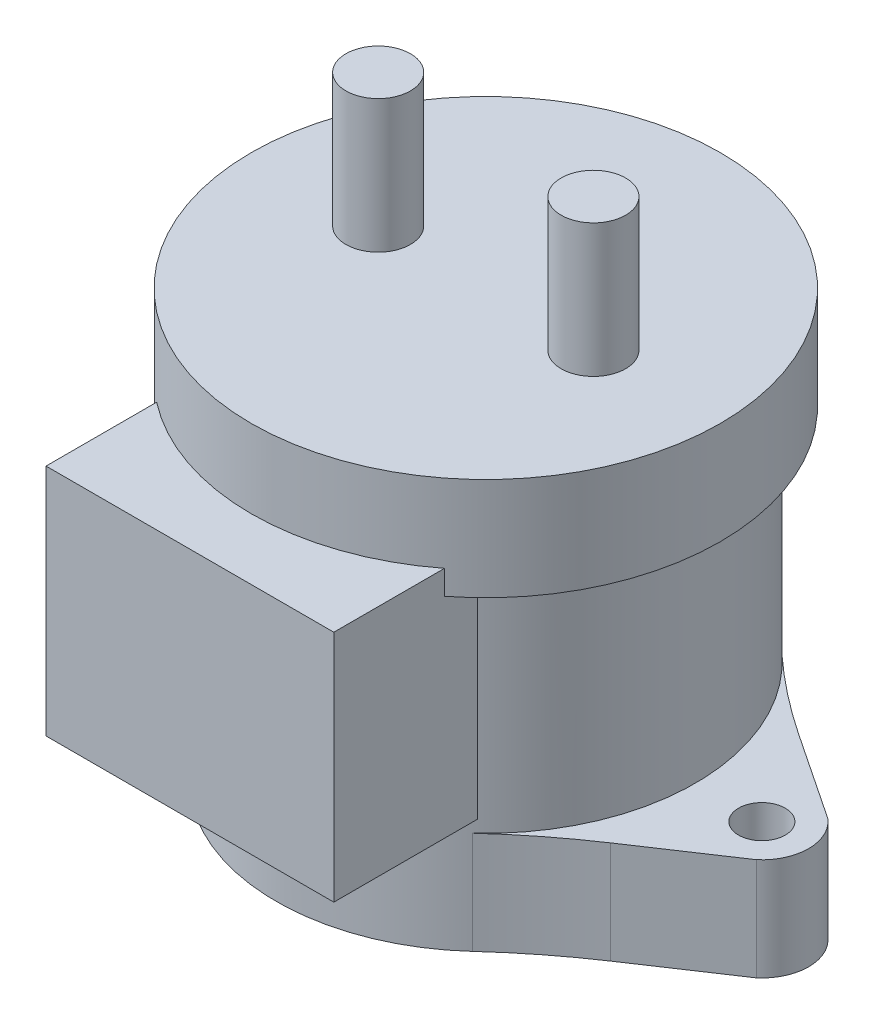
from build123d import *

# Parameters (mm, degrees)
SKETCH1_R           = 26
BOSS_EXTRUDE1_DEPTH = 14.2
SKETCH4_R           = 2.9
BOSS_EXTRUDE2_DEPTH = 12.7
BOSS_EXTRUDE3_DEPTH = 29
SKETCH8_R           = 26
BOSS_EXTRUDE4_DEPTH = 26
SKETCH9_R           = 29.1
BOSS_EXTRUDE5_DEPTH = 12.7
SKETCH10_R          = 4
BOSS_EXTRUDE6_DEPTH = 16.5


with BuildPart() as part:
    # Sketch1 → Boss-Extrude1 (new body)
    with BuildSketch(Plane(origin=(0, 0, 0), x_dir=(1, 0, 0), z_dir=(0, 1, 0))):
        Circle(SKETCH1_R)
    extrude(amount=BOSS_EXTRUDE1_DEPTH)

    # Sketch4 → Boss-Extrude2 (add)
    with BuildSketch(Plane.XZ):
        with BuildLine():
            Line((27.12908409, -11.679561866), (37.990088974, -4.433027686))
            ThreePointArc((37.990088974, -4.433027686), (40.05, 0), (37.990088974, 4.433027686))
            Line((37.990088974, 4.433027686), (27.12908409, 11.679561866))
            ThreePointArc((27.12908409, 11.679561866), (22.194049101, 15.251075575), (17.545087541, 19.18775399))
            ThreePointArc((17.545087541, 19.18775399), (0, 26), (-17.545087541, 19.18775399))
            ThreePointArc((-17.545087541, 19.18775399), (-22.194049101, 15.251075575), (-27.12908409, 11.679561866))
            Line((-27.12908409, 11.679561866), (-37.990088974, 4.433027686))
            ThreePointArc((-37.990088974, 4.433027686), (-40.05, 0), (-37.990088974, -4.433027686))
            Line((-37.990088974, -4.433027686), (-27.12908409, -11.679561866))
            ThreePointArc((-27.12908409, -11.679561866), (-22.194049101, -15.251075575), (-17.545087541, -19.18775399))
            ThreePointArc((-17.545087541, -19.18775399), (0, -26), (17.545087541, -19.18775399))
            ThreePointArc((17.545087541, -19.18775399), (22.194049101, -15.251075575), (27.12908409, -11.679561866))
        make_face()
        with Locations((34.25, 0)):
            Circle(SKETCH4_R, mode=Mode.SUBTRACT)
        with Locations((-34.25, 0)):
            Circle(SKETCH4_R, mode=Mode.SUBTRACT)
    extrude(amount=-BOSS_EXTRUDE2_DEPTH)



with BuildPart() as body_2:
    # Sketch6 → Boss-Extrude3 (new body)
    with BuildSketch(Plane(origin=(0, 14.2, 0), x_dir=(1, 0, 0), z_dir=(0, 1, 0))):
        with BuildLine():
            Line((-17.85, -26.563609898), (-17.85, -18.904430698))
            ThreePointArc((-17.85, -18.904430698), (0, -26), (17.85, -18.904430698))
            Line((17.85, -18.904430698), (17.85, -26.799580221))
            Line((17.85, -26.799580221), (17.85, -36.7))
            Line((17.85, -36.7), (0, -36.7))
            Line((0, -36.7), (-17.85, -36.7))
            Line((-17.85, -36.7), (-17.85, -26.799580221))
            Line((-17.85, -26.799580221), (-17.85, -26.563609898))
        make_face()
    extrude(amount=BOSS_EXTRUDE3_DEPTH)


with BuildPart() as part_1:
    add(part.part)

    add(body_2.part)  # Boss-Extrude4 merges body 2
    # Sketch8 → Boss-Extrude4 (add)
    with BuildSketch(Plane(origin=(0, 14.2, 0), x_dir=(1, 0, 0), z_dir=(0, 1, 0))):
        Circle(SKETCH8_R)
    extrude(amount=BOSS_EXTRUDE4_DEPTH)

    # Sketch9 → Boss-Extrude5 (add)
    with BuildSketch(Plane(origin=(0, 40.2, 0), x_dir=(1, 0, 0), z_dir=(0, 1, 0))):
        Circle(SKETCH9_R)
    extrude(amount=BOSS_EXTRUDE5_DEPTH)

    # Sketch10 → Boss-Extrude6 (add)
    with BuildSketch(Plane(origin=(0, 52.9, 0), x_dir=(1, 0, 0), z_dir=(0, 1, 0))):
        with Locations((13.35, 0)):
            Circle(SKETCH10_R)
        with Locations((-13.35, 0)):
            Circle(SKETCH10_R)
    extrude(amount=BOSS_EXTRUDE6_DEPTH)


solid = part_1.part
